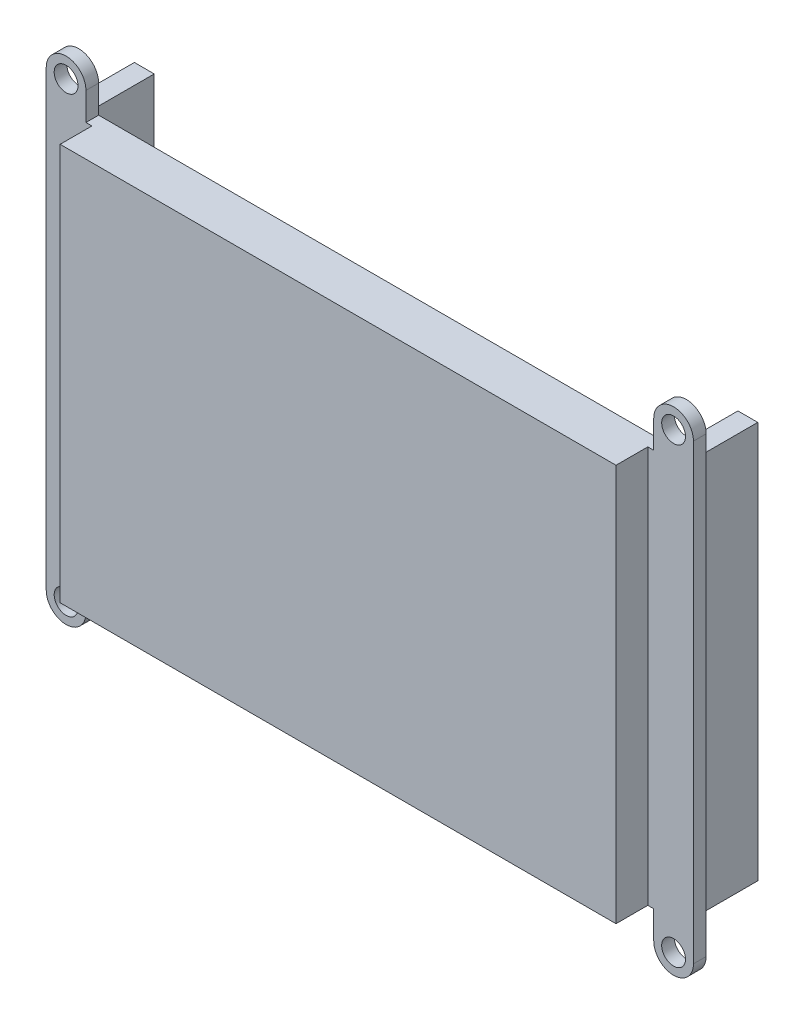
from build123d import *

# Parameters (mm, degrees)
SKETCH1_W             = 70
SKETCH1_H             = 50
BOSS_EXTRUDE1_DEPTH   = 4
SKETCH2_W             = 81.5
SKETCH2_H             = 50
BOSS_EXTRUDE2_DEPTH   = 1.6
SKETCH4_R             = 1.5
BOSS_EXTRUDE3_DEPTH   = 1.6
BOSS_EXTRUDE3_2_DEPTH = 1.6
BOSS_EXTRUDE3_3_DEPTH = 1.6
BOSS_EXTRUDE3_4_DEPTH = 1.6
SKETCH5_W             = 2.5
SKETCH5_H             = 50
BOSS_EXTRUDE4_DEPTH   = 8


with BuildPart() as part:
    # Sketch1 → Boss-Extrude1 (new body)
    with BuildSketch(Plane.XY):
        Rectangle(SKETCH1_W, SKETCH1_H)
    extrude(amount=BOSS_EXTRUDE1_DEPTH)

    # Sketch2 → Boss-Extrude2 (add)
    with BuildSketch(Plane(origin=(0, 0, 0), x_dir=(-1, 0, 0), z_dir=(0, 0, -1))):
        Rectangle(SKETCH2_W, SKETCH2_H)
    extrude(amount=BOSS_EXTRUDE2_DEPTH)



with BuildPart() as body_2:
    # Sketch4 → Boss-Extrude3 (new body)
    with BuildSketch(Plane.XY):
        with BuildLine():
            Line((-40.75, 28.5), (-40.75, 25))
            Line((-40.75, 25), (-35.75, 25))
            Line((-35.75, 25), (-35.75, 28.5))
            ThreePointArc((-35.75, 28.5), (-38.25, 31), (-40.75, 28.5))
        make_face()
        with Locations((-38.25, 28.5)):
            Circle(SKETCH4_R, mode=Mode.SUBTRACT)
    extrude(amount=-BOSS_EXTRUDE3_DEPTH)


with BuildPart() as body_3:
    # Sketch4 → Boss-Extrude3 2 (new body)
    with BuildSketch(Plane.XY):
        with BuildLine():
            Line((-35.75, -25), (-35.75, -28.5))
            ThreePointArc((-35.75, -28.5), (-38.25, -31), (-40.75, -28.5))
            Line((-40.75, -28.5), (-40.75, -25))
            Line((-40.75, -25), (-35.75, -25))
        make_face()
        with Locations((-38.25, -28.5)):
            Circle(SKETCH4_R, mode=Mode.SUBTRACT)
    extrude(amount=-BOSS_EXTRUDE3_2_DEPTH)


with BuildPart() as body_4:
    # Sketch4 → Boss-Extrude3 3 (new body)
    with BuildSketch(Plane.XY):
        with BuildLine():
            Line((40.75, -28.5), (40.75, -25))
            Line((40.75, -25), (35.75, -25))
            Line((35.75, -25), (35.75, -28.5))
            ThreePointArc((35.75, -28.5), (38.25, -31), (40.75, -28.5))
        make_face()
        with Locations((38.25, -28.5)):
            Circle(SKETCH4_R, mode=Mode.SUBTRACT)
    extrude(amount=-BOSS_EXTRUDE3_3_DEPTH)


with BuildPart() as body_5:
    # Sketch4 → Boss-Extrude3 4 (new body)
    with BuildSketch(Plane.XY):
        with BuildLine():
            Line((35.75, 25), (35.75, 28.5))
            ThreePointArc((35.75, 28.5), (38.25, 31), (40.75, 28.5))
            Line((40.75, 28.5), (40.75, 25))
            Line((40.75, 25), (35.75, 25))
        make_face()
        with Locations((38.25, 28.5)):
            Circle(SKETCH4_R, mode=Mode.SUBTRACT)
    extrude(amount=-BOSS_EXTRUDE3_4_DEPTH)


with BuildPart() as part_1:
    add(part.part)

    add(body_2.part)  # Boss-Extrude4 merges body 2

    add(body_3.part)  # Boss-Extrude4 merges body 3

    add(body_4.part)  # Boss-Extrude4 merges body 4

    add(body_5.part)  # Boss-Extrude4 merges body 5
    # Sketch5 → Boss-Extrude4 (add)
    with BuildSketch(Plane(origin=(0, 0, -1.6), x_dir=(-1, 0, 0), z_dir=(0, 0, -1))):
        with Locations((-38, 0)):
            Rectangle(SKETCH5_W, SKETCH5_H)
        with Locations((38, 0)):
            Rectangle(SKETCH5_W, SKETCH5_H)
    extrude(amount=BOSS_EXTRUDE4_DEPTH)


solid = part_1.part
